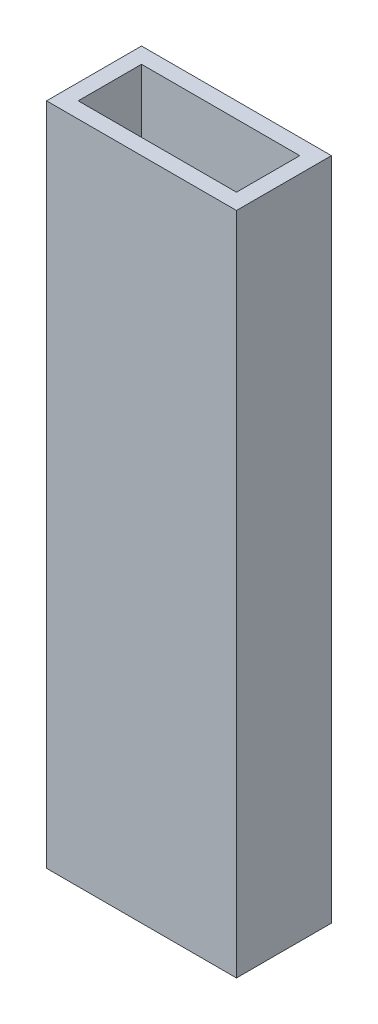
from build123d import *

# Parameters (mm, degrees)
SKETCH1_W           = 38.1
SKETCH1_H           = 19.05
SKETCH1_W_2         = 31.75
SKETCH1_H_2         = 12.7
BOSS_EXTRUDE1_DEPTH = 133.35


with BuildPart() as part:
    # Sketch1 → Boss-Extrude1 (new body)
    with BuildSketch(Plane(origin=(0, 0, 0), x_dir=(1, 0, 0), z_dir=(0, 1, 0))):
        with Locations((19.05, 9.525)):
            Rectangle(SKETCH1_W, SKETCH1_H)
        with Locations((19.05, 9.525)):
            Rectangle(SKETCH1_W_2, SKETCH1_H_2, mode=Mode.SUBTRACT)
    extrude(amount=BOSS_EXTRUDE1_DEPTH)


solid = part.part
